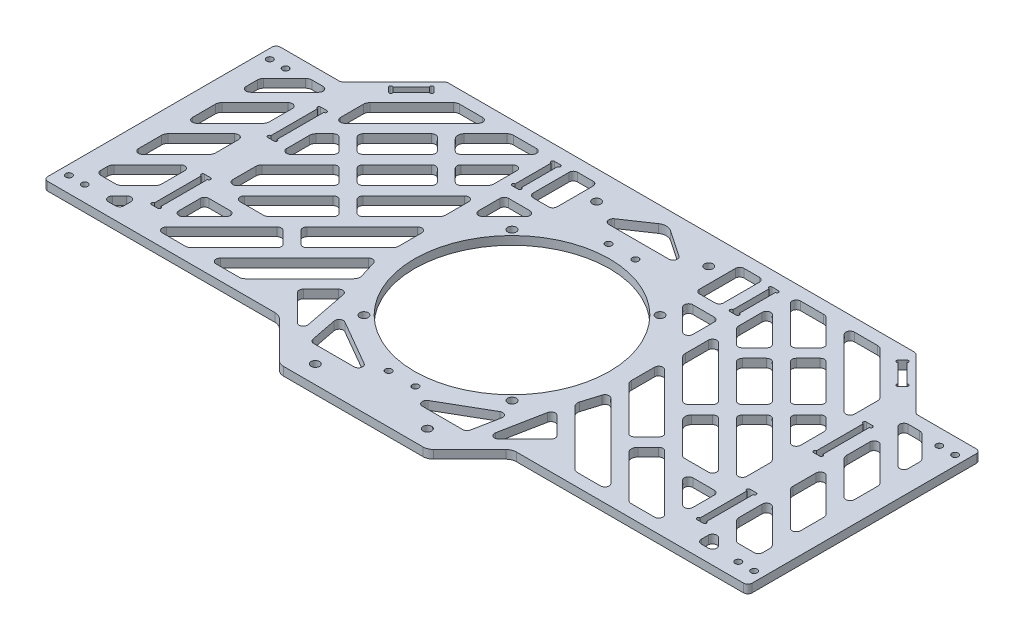
from build123d import *

# Parameters (mm, degrees)
SKETCH_1_R          = 46.1
SKETCH_1_R_2        = 2
SKETCH_1_R_3        = 1.5
SKETCH_1_W          = 3
SKETCH_1_H          = 25
EXTRUDE_1_DEPTH     = 4
SKETCH_2_R          = 2
SKETCH_2_R_2        = 1.5
SKETCH_2_W          = 3
SKETCH_2_H          = 20
CUT_EXTRUDE_1_DEPTH = 185.765391781
SKETCH_3_R          = 0.75
CUT_EXTRUDE_2_DEPTH = 185.765391781
SKETCH_12_W         = 11.319116267
SKETCH_12_H         = 21
CUT_EXTRUDE_8_DEPTH = 185.765391781
SKETCH_13_W         = 6
SKETCH_13_H         = 24.213203436
SKETCH_13_W_2       = 24.213203436
SKETCH_13_H_2       = 6
EXTRUDE_1_2_DEPTH   = 4
FILLET_1_R          = 5
FILLET_2_R          = 2
FILLET_3_R          = 2
FILLET_4_R          = 3


with BuildPart() as part:
    # 草图1 → Extrude 1 (new body)
    with BuildSketch(Plane(origin=(0, 0, 0), x_dir=(1, 0, 0), z_dir=(0, 1, 0))):
        Polygon((-55, -55), (-35, -75), (35, -75), (55, -55), (166.5, -55), (166.5, 55), (135.989541598, 55), (110.989541598, 80), (-110.989541598, 80), (-135.989541598, 55), (-166.5, 55), (-166.5, -55), align=None)
        with Locations(Location((0, 0, 0), (0, 0, 270))):
            Circle(SKETCH_1_R, mode=Mode.SUBTRACT)
        with Locations(Location((-26.5, 66.5, 0), (0, 0, 270))):
            Circle(SKETCH_1_R_2, mode=Mode.SUBTRACT)
        with Locations(Location((26.5, 66.5, 0), (0, 0, 270))):
            Circle(SKETCH_1_R_2, mode=Mode.SUBTRACT)
        with Locations(Location((26.5, -66.5, 0), (0, 0, 270))):
            Circle(SKETCH_1_R_2, mode=Mode.SUBTRACT)
        with Locations(Location((-26.5, -66.5, 0), (0, 0, 270))):
            Circle(SKETCH_1_R_2, mode=Mode.SUBTRACT)
        with Locations(Location((-162, 47.5, 0), (0, 0, 270))):
            Circle(SKETCH_1_R_3, mode=Mode.SUBTRACT)
        with Locations(Location((-154.5, 47.5, 0), (0, 0, 270))):
            Circle(SKETCH_1_R_3, mode=Mode.SUBTRACT)
        with Locations(Location((-154.5, -47.5, 0), (0, 0, 270))):
            Circle(SKETCH_1_R_3, mode=Mode.SUBTRACT)
        with Locations(Location((-162, -47.5, 0), (0, 0, 270))):
            Circle(SKETCH_1_R_3, mode=Mode.SUBTRACT)
        with Locations(Location((154.5, -47.5, 0), (0, 0, 90))):
            Circle(SKETCH_1_R_3, mode=Mode.SUBTRACT)
        with Locations(Location((162, -47.5, 0), (0, 0, 90))):
            Circle(SKETCH_1_R_3, mode=Mode.SUBTRACT)
        with Locations(Location((154.5, 47.5, 0), (0, 0, 90))):
            Circle(SKETCH_1_R_3, mode=Mode.SUBTRACT)
        with Locations(Location((162, 47.5, 0), (0, 0, 90))):
            Circle(SKETCH_1_R_3, mode=Mode.SUBTRACT)
        with Locations((-129, 27.5)):
            Rectangle(SKETCH_1_W, SKETCH_1_H, mode=Mode.SUBTRACT)
        with Locations((129, -27.5)):
            Rectangle(SKETCH_1_W, SKETCH_1_H, mode=Mode.SUBTRACT)
        with Locations((129, 27.5)):
            Rectangle(SKETCH_1_W, SKETCH_1_H, mode=Mode.SUBTRACT)
        with Locations((-129, -27.5)):
            Rectangle(SKETCH_1_W, SKETCH_1_H, mode=Mode.SUBTRACT)
    extrude(amount=EXTRUDE_1_DEPTH)

    # 草图2 → 切除-拉伸1 (cut, through all)
    with BuildSketch(Plane(origin=(0, 4, 0), x_dir=(1, 0, 0), z_dir=(0, 1, 0))):
        with Locations(Location((-35.001785669, 35.001785669, 0), (0, 0, 270))):
            Circle(SKETCH_2_R)
        with Locations(Location((35.001785669, 35.001785669, 0), (0, 0, 90))):
            Circle(SKETCH_2_R)
        with Locations(Location((35.001785669, -35.001785669, 0), (0, 0, 270))):
            Circle(SKETCH_2_R)
        with Locations(Location((-35.001785669, -35.001785669, 0), (0, 0, 90))):
            Circle(SKETCH_2_R)
        with Locations(Location((-6.35, 52, 0), (0, 0, 270))):
            Circle(SKETCH_2_R_2)
        with Locations(Location((6.35, 52, 0), (0, 0, 90))):
            Circle(SKETCH_2_R_2)
        with Locations(Location((6.35, -52, 0), (0, 0, 270))):
            Circle(SKETCH_2_R_2)
        with Locations(Location((-6.35, -52, 0), (0, 0, 90))):
            Circle(SKETCH_2_R_2)
        with Locations((51.5, 63)):
            Rectangle(SKETCH_2_W, SKETCH_2_H)
        with Locations((-51.5, 63)):
            Rectangle(SKETCH_2_W, SKETCH_2_H)
        Polygon((111.802229458, 74.944671454), (109.680909114, 72.82335111), (120.428932188, 62.075328036), (122.550252532, 64.19664838), align=None)
        Polygon((-120.428932188, 62.075328036), (-109.680909114, 72.82335111), (-111.802229458, 74.944671454), (-122.550252532, 64.19664838), align=None)
    extrude(amount=-CUT_EXTRUDE_1_DEPTH, mode=Mode.SUBTRACT)

    # 草图3 → 切除-拉伸2 (cut, through all)
    with BuildSketch(Plane(origin=(0, 4, 0), x_dir=(1, 0, 0), z_dir=(0, 1, 0))):
        with Locations((-53, 72.25)):
            Circle(SKETCH_3_R)
        with Locations((-50, 72.25)):
            Circle(SKETCH_3_R)
        with Locations((-50, 53.75)):
            Circle(SKETCH_3_R)
        with Locations((-53, 53.75)):
            Circle(SKETCH_3_R)
        with Locations((53, 53.75)):
            Circle(SKETCH_3_R)
        with Locations((50, 53.75)):
            Circle(SKETCH_3_R)
        with Locations((50, 72.25)):
            Circle(SKETCH_3_R)
        with Locations((53, 72.25)):
            Circle(SKETCH_3_R)
        with Locations((-112.332559544, 74.414341368)):
            Circle(SKETCH_3_R)
        with Locations((-122.019922446, 64.726978466)):
            Circle(SKETCH_3_R)
        with Locations((-119.898602102, 62.605658122)):
            Circle(SKETCH_3_R)
        with Locations((-110.2112392, 72.293021024)):
            Circle(SKETCH_3_R)
        with Locations((-130.5, 39.25)):
            Circle(SKETCH_3_R)
        with Locations((-127.5, 39.25)):
            Circle(SKETCH_3_R)
        with Locations((-127.5, 15.75)):
            Circle(SKETCH_3_R)
        with Locations((-130.5, 15.75)):
            Circle(SKETCH_3_R)
        with Locations((-130.5, -15.75)):
            Circle(SKETCH_3_R)
        with Locations((-127.5, -15.75)):
            Circle(SKETCH_3_R)
        with Locations((-127.5, -39.25)):
            Circle(SKETCH_3_R)
        with Locations((-130.5, -39.25)):
            Circle(SKETCH_3_R)
        with Locations((130.5, -39.25)):
            Circle(SKETCH_3_R)
        with Locations((127.5, -39.25)):
            Circle(SKETCH_3_R)
        with Locations((127.5, -15.75)):
            Circle(SKETCH_3_R)
        with Locations((130.5, -15.75)):
            Circle(SKETCH_3_R)
        with Locations((130.5, 15.75)):
            Circle(SKETCH_3_R)
        with Locations((127.5, 15.75)):
            Circle(SKETCH_3_R)
        with Locations((127.5, 39.25)):
            Circle(SKETCH_3_R)
        with Locations((130.5, 39.25)):
            Circle(SKETCH_3_R)
        with Locations((110.2112392, 72.293021024)):
            Circle(SKETCH_3_R)
        with Locations((119.898602102, 62.605658122)):
            Circle(SKETCH_3_R)
        with Locations((122.019922446, 64.726978466)):
            Circle(SKETCH_3_R)
        with Locations((112.332559544, 74.414341368)):
            Circle(SKETCH_3_R)
    extrude(amount=-CUT_EXTRUDE_2_DEPTH, mode=Mode.SUBTRACT)

    # 草图12 → 切除-拉伸8 (cut, through all)
    with BuildSketch(Plane(origin=(0, 4, 0), x_dir=(1, 0, 0), z_dir=(0, 1, 0))):
        Polygon((-136.5, -13.392709395), (-136.5, -30.363272144), (-146.136727856, -40), (-156.5, -40), (-156.5, -33.392709395), align=None)
        Polygon((-136.5, 12.063134727), (-136.5, -4.907428021), (-156.5, -24.907428021), (-156.5, -7.936865273), align=None)
        Polygon((-156.5, 17.51897885), (-156.5, 0.548416102), (-136.5, 20.548416102), (-136.5, 37.51897885), align=None)
        Polygon((-136.5, -38.848553518), (-146.651446482, -49), (-136.5, -49), align=None)
        Polygon((-100.01897885, 74), (-121.5, 52.51897885), (-121.5, 35.548416102), (-83.048416102, 74), align=None)
        Polygon((-74.563134727, 74), (-57.592571979, 74), (-121.5, 10.092571979), (-121.5, 27.063134727), align=None)
        Polygon((-58, 65.107290605), (-58, 48.136727856), (-121.5, -15.363272144), (-121.5, 1.607290605), align=None)
        Polygon((-144.817968723, 49), (-156.5, 37.317968723), (-156.5, 26.004260224), (-133.504260224, 49), align=None)
        Polygon((-50.651446482, 47), (-33.680883733, 47), (-121.5, -40.819116267), (-121.5, -23.848553518), align=None)
        Polygon((-121.195602359, -49), (-55, 17.195602359), (-55, 0.225039611), (-104.225039611, -49), align=None)
        Polygon((-55, -8.260241764), (-95.739758236, -49), (-78.769195488, -49), (-51.010781659, -21.241586171), align=None)
        Polygon((-49.016172489, -27.732258375), (-61.39931637, -40.115402256), (-43.014718626, -58.5), align=None)
        Polygon((-20.680883733, 60), (0, 74), (20.680883733, 60), align=None)
        with Locations((-39.340441867, 63.5)):
            Rectangle(SKETCH_12_W, SKETCH_12_H)
        Polygon((-40.483823148, -40.135183418), (-36.9016428, -58.5), (-8.675027757, -58.5), align=None)
        Polygon((8.675027757, -58.5), (40.483823148, -40.135183418), (36.9016428, -58.5), align=None)
        Polygon((133.504260224, 49), (156.5, 26.004260224), (156.5, 37.317968723), (144.817968723, 49), align=None)
        Polygon((136.5, 37.51897885), (156.5, 17.51897885), (156.5, 0.548416102), (136.5, 20.548416102), align=None)
        Polygon((136.5, -30.363272144), (146.136727856, -40), (156.5, -40), (156.5, -33.392709395), (136.5, -13.392709395), align=None)
        Polygon((136.5, -4.907428021), (156.5, -24.907428021), (156.5, -7.936865273), (136.5, 12.063134727), align=None)
        with Locations((39.340441867, 63.5)):
            Rectangle(SKETCH_12_W, SKETCH_12_H)
        Polygon((43.014718626, -58.5), (49.016172489, -27.732258375), (61.39931637, -40.115402256), align=None)
        Polygon((51.010781659, -21.241586171), (55, -8.260241764), (95.739758236, -49), (78.769195488, -49), align=None)
        Polygon((121.5, -23.848553518), (121.5, -40.819116267), (33.680883733, 47), (50.651446482, 47), align=None)
        Polygon((121.5, 1.607290605), (121.5, -15.363272144), (58, 48.136727856), (58, 65.107290605), align=None)
        Polygon((121.5, 27.063134727), (121.5, 10.092571979), (57.592571979, 74), (74.563134727, 74), align=None)
        Polygon((104.225039611, -49), (121.195602359, -49), (55, 17.195602359), (55, 0.225039611), align=None)
        Polygon((83.048416102, 74), (121.5, 35.548416102), (121.5, 52.51897885), (100.01897885, 74), align=None)
        Polygon((136.5, -49), (136.5, -38.848553518), (146.651446482, -49), align=None)
    extrude(amount=-CUT_EXTRUDE_8_DEPTH, mode=Mode.SUBTRACT)

    # 草图13 → Extrude 1 2 (add)
    with BuildSketch(Plane(origin=(0, 4, 0), x_dir=(1, 0, 0), z_dir=(0, 1, 0))):
        with Locations((-53.651446482, 34.893398282)):
            Rectangle(SKETCH_13_W, SKETCH_13_H)
        Polygon((-90.219121523, -18.023519164), (-81.733840149, -26.508800538), (-77.491199462, -22.266159851), (-85.976480836, -13.780878477), align=None)
        with Locations((-109.393398282, -20.848553518)):
            Rectangle(SKETCH_13_W_2, SKETCH_13_H_2)
        Polygon((-115.136038969, 33.427095758), (-81.194913472, -0.514029739), (-76.952272785, 3.728610948), (-110.893398282, 37.669736445), align=None)
        Polygon((-66.485281374, 39.651446482), (-87.69848481, 60.864649917), (-91.941125497, 56.62200923), (-70.727922061, 35.408805795), align=None)
        Polygon((70.727922061, 35.408805795), (91.941125497, 56.62200923), (87.69848481, 60.864649917), (66.485281374, 39.651446482), align=None)
        Polygon((110.893398282, 37.669736445), (76.952272785, 3.728610948), (81.194913472, -0.514029739), (115.136038969, 33.427095758), align=None)
        with Locations((109.393398282, -20.848553518)):
            Rectangle(SKETCH_13_W_2, SKETCH_13_H_2)
        Polygon((85.976480836, -13.780878477), (77.491199462, -22.266159851), (81.733840149, -26.508800538), (90.219121523, -18.023519164), align=None)
        with Locations((53.651446482, 34.893398282)):
            Rectangle(SKETCH_13_W, SKETCH_13_H)
    extrude(amount=-EXTRUDE_1_2_DEPTH)

    # 圆角1
    fillet_1_edges = [part.edges().sort_by_distance(p)[0] for p in [
        (55, 2, 55),
        (35, 2, 75),
        (-35, 2, 75),
        (-55, 2, 55),
        (0, 2, -74),
    ]]
    fillet(fillet_1_edges, radius=FILLET_1_R)

    # 圆角2
    fillet_2_edges = [part.edges().sort_by_distance(p)[0] for p in [
        (-166.5, 2, 55),
        (-166.5, 2, -55),
        (-135.989541598, 2, -55),
        (-110.989541598, 2, -80),
        (110.989541598, 2, -80),
        (135.989541598, 2, -55),
        (166.5, 2, -55),
        (166.5, 2, 55),
    ]]
    fillet(fillet_2_edges, radius=FILLET_2_R)

    # 圆角3
    fillet_3_edges = [part.edges().sort_by_distance(p)[0] for p in [
        (-102.408116908, 2, -29.184455071),
        (-110.893398282, 2, -37.669736445),
        (-98.165476221, 2, -24.941814384),
        (-89.680194847, 2, -16.456533009),
        (-85.437554159, 2, -12.213892322),
        (-106.650757595, 2, -24.941814384),
        (-102.408116908, 2, -20.699173697),
        (-81.194913472, 2, 0.514029739),
        (-76.952272785, 2, -3.728610948),
        (-115.136038969, 2, -33.427095758),
        (-93.922835534, 2, -12.213892322),
        (-89.680194847, 2, -7.971251635),
        (83.455844123, 2, -48.136727856),
        (79.213203436, 2, -52.379368543),
        (74.970562748, 2, -48.136727856),
        (66.485281374, 2, -39.651446482),
        (91.941125497, 2, -56.62200923),
        (87.69848481, 2, -60.864649917),
        (70.727922061, 2, -35.408805795),
        (79.213203436, 2, -43.894087169),
        (102.408116908, 2, -20.699173697),
        (93.922835534, 2, -12.213892322),
        (106.650757595, 2, -24.941814384),
        (115.136038969, 2, -33.427095758),
        (89.680194847, 2, -7.971251635),
        (98.165476221, 2, -24.941814384),
        (102.408116908, 2, -29.184455071),
        (76.952272785, 2, -3.728610948),
        (110.893398282, 2, -37.669736445),
        (89.680194847, 2, -16.456533009),
        (85.437554159, 2, -12.213892322),
        (115.5, 2, 17.848553518),
        (104.529437252, 2, 23.848553518),
        (98.529437252, 2, 17.848553518),
        (90.219121523, 2, 18.023519164),
        (85.976480836, 2, 13.780878477),
        (77.491199462, 2, 22.266159851),
        (56.651446482, 2, -41),
        (50.651446482, 2, -30.029437252),
        (-136.5, 2, 38.848553518),
        (-136.5, 2, 49),
        (-146.651446482, 2, 49),
        (-156.5, 2, 40),
        (-136.5, 2, 13.392709395),
        (-40.483823148, 2, 40.135183418),
        (-8.675027757, 2, 58.5),
        (-36.9016428, 2, 58.5),
        (-136.5, 2, -37.51897885),
        (-156.5, 2, -0.548416102),
        (-136.5, 2, -12.063134727),
        (-156.5, 2, 24.907428021),
        (-133.504260224, 2, -49),
        (-156.5, 2, -26.004260224),
        (36.9016428, 2, 58.5),
        (8.675027757, 2, 58.5),
        (40.483823148, 2, 40.135183418),
        (50.651446482, 2, -47),
        (121.5, 2, 23.848553518),
        (121.5, 2, 40.819116267),
        (33.680883733, 2, -47),
        (-58, 2, -65.107290605),
        (-121.5, 2, 15.363272144),
        (-121.5, 2, 23.848553518),
        (-50.651446482, 2, -47),
        (-33.680883733, 2, -47),
        (-121.5, 2, 40.819116267),
        (-57.592571979, 2, -74),
        (-121.5, 2, -10.092571979),
        (-55, 2, 8.260241764),
        (-95.739758236, 2, 49),
        (-49.016172489, 2, 27.732258375),
        (-43.014718626, 2, 58.5),
        (-61.39931637, 2, 40.115402256),
        (-121.195602359, 2, 49),
        (-55, 2, -17.195602359),
        (20.680883733, 2, -60),
        (-20.680883733, 2, -60),
        (-45, 2, -53),
        (-45, 2, -74),
        (-33.680883733, 2, -74),
        (-33.680883733, 2, -53),
        (55, 2, -17.195602359),
        (121.195602359, 2, 49),
        (121.5, 2, -10.092571979),
        (57.592571979, 2, -74),
        (83.048416102, 2, -74),
        (121.5, 2, -35.548416102),
        (146.651446482, 2, 49),
        (136.5, 2, 49),
        (136.5, 2, 38.848553518),
        (33.680883733, 2, -74),
        (45, 2, -74),
        (45, 2, -53),
        (33.680883733, 2, -53),
        (61.39931637, 2, 40.115402256),
        (43.014718626, 2, 58.5),
        (49.016172489, 2, 27.732258375),
        (58, 2, -65.107290605),
        (121.5, 2, 15.363272144),
        (55, 2, 8.260241764),
        (95.739758236, 2, 49),
        (136.5, 2, -37.51897885),
        (156.5, 2, -0.548416102),
        (133.504260224, 2, -49),
        (156.5, 2, -26.004260224),
        (136.5, 2, -12.063134727),
        (156.5, 2, 24.907428021),
        (136.5, 2, 13.392709395),
        (156.5, 2, 40),
        (146.136727856, 2, 40),
        (-83.048416102, 2, -74),
        (-121.5, 2, -35.548416102),
        (-50.651446482, 2, -30.029437252),
        (-56.651446482, 2, -41),
        (-115.5, 2, 17.848553518),
        (-104.529437252, 2, 23.848553518),
        (-77.491199462, 2, 22.266159851),
        (-85.976480836, 2, 13.780878477),
        (-90.219121523, 2, 18.023519164),
        (-81.733840149, 2, 26.508800538),
        (-83.455844123, 2, -48.136727856),
        (-79.213203436, 2, -43.894087169),
        (-70.727922061, 2, -35.408805795),
        (-91.941125497, 2, -56.62200923),
        (-66.485281374, 2, -39.651446482),
        (-79.213203436, 2, -52.379368543),
        (-74.970562748, 2, -48.136727856),
    ]]
    fillet(fillet_3_edges, radius=FILLET_3_R)

    # 圆角4
    fillet_4_edges = [part.edges().sort_by_distance(p)[0] for p in [
        (81.194913472, 2, 0.514029739),
        (81.733840149, 2, 26.508800538),
        (56.651446482, 2, -24.029437252),
        (-146.136727856, 2, 40),
        (-156.5, 2, 33.392709395),
        (-136.5, 2, 30.363272144),
        (-136.5, 2, -20.548416102),
        (-156.5, 2, -17.51897885),
        (-156.5, 2, 7.936865273),
        (-136.5, 2, 4.907428021),
        (-144.817968723, 2, -49),
        (-156.5, 2, -37.317968723),
        (-121.5, 2, -1.607290605),
        (-58, 2, -48.136727856),
        (-121.5, 2, -27.063134727),
        (-74.563134727, 2, -74),
        (-51.010781659, 2, 21.241586171),
        (-78.769195488, 2, 49),
        (-104.225039611, 2, 49),
        (-55, 2, -0.225039611),
        (104.225039611, 2, 49),
        (55, 2, -0.225039611),
        (74.563134727, 2, -74),
        (121.5, 2, -27.063134727),
        (100.01897885, 2, -74),
        (121.5, 2, -52.51897885),
        (121.5, 2, -1.607290605),
        (58, 2, -48.136727856),
        (78.769195488, 2, 49),
        (51.010781659, 2, 21.241586171),
        (136.5, 2, -20.548416102),
        (156.5, 2, -17.51897885),
        (144.817968723, 2, -49),
        (156.5, 2, -37.317968723),
        (136.5, 2, 4.907428021),
        (156.5, 2, 7.936865273),
        (136.5, 2, 30.363272144),
        (156.5, 2, 33.392709395),
        (-100.01897885, 2, -74),
        (-121.5, 2, -52.51897885),
        (-56.651446482, 2, -24.029437252),
        (-98.529437252, 2, 17.848553518),
        (-87.69848481, 2, -60.864649917),
    ]]
    fillet(fillet_4_edges, radius=FILLET_4_R)


solid = part.part
